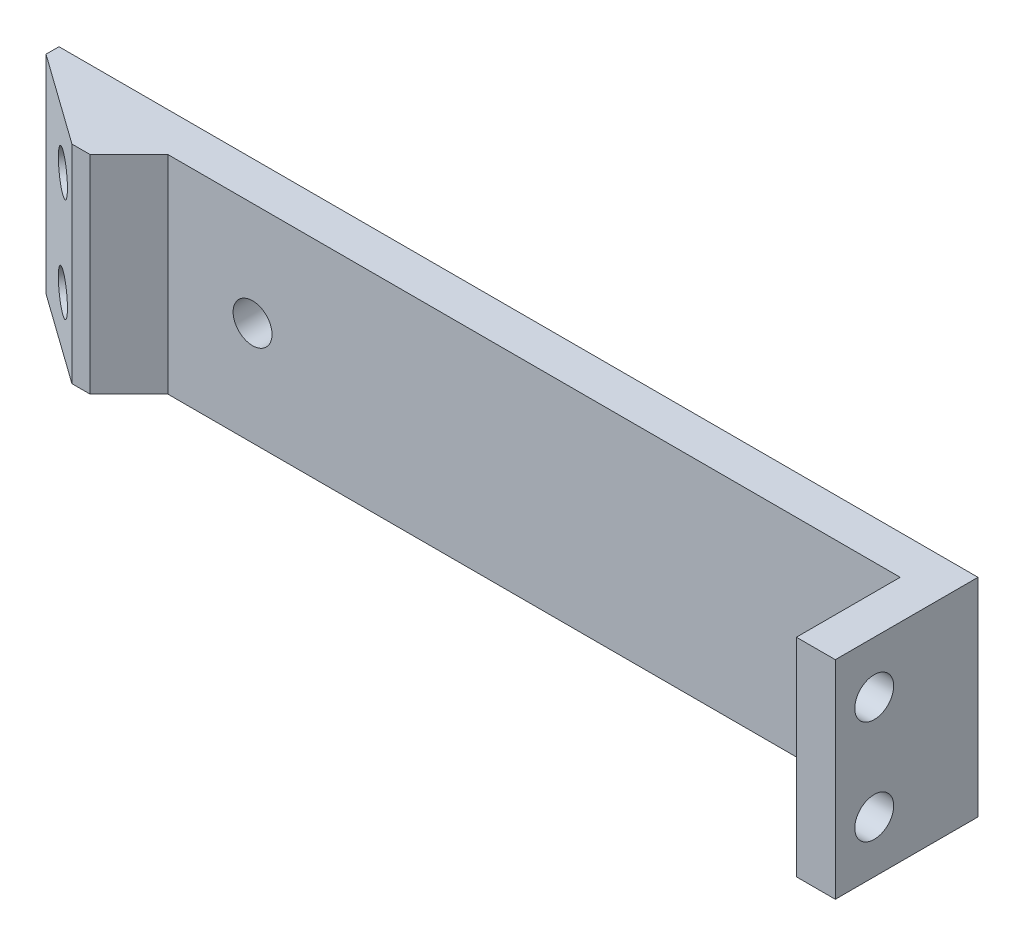
from build123d import *

# Parameters (mm, degrees)
SKETCH1_W           = 70.85
SKETCH1_H           = 16
BOSS_EXTRUDE1_DEPTH = 3
SKETCH2_W           = 8.4
SKETCH2_H           = 16
BOSS_EXTRUDE2_DEPTH = 3
CHAMFER1_SIZE       = 5
CHAMFER1_SIZE2      = 7
SKETCH3_R           = 1.5
CUT_EXTRUDE1_DEPTH  = 3
CHAMFER2_SIZE       = 3
CUT_EXTRUDE2_START  = -3
CUT_EXTRUDE2_DEPTH  = 8
SKETCH5_W           = 3
SKETCH5_H           = 16
BOSS_EXTRUDE3_DEPTH = 8
SKETCH6_R           = 1.5
CUT_EXTRUDE3_DEPTH  = 8
SKETCH7_R           = 1.5
CUT_EXTRUDE4_DEPTH  = 10


with BuildPart() as part:
    # Sketch1 → Boss-Extrude1 (new body)
    with BuildSketch(Plane.XY):
        Rectangle(SKETCH1_W, SKETCH1_H)
    extrude(amount=BOSS_EXTRUDE1_DEPTH)

    # Sketch2 → Boss-Extrude2 (add)
    with BuildSketch(Plane.XY.offset(3)):
        with Locations((-31.225, 0)):
            Rectangle(SKETCH2_W, SKETCH2_H)
    extrude(amount=BOSS_EXTRUDE2_DEPTH)

    # Chamfer1
    chamfer1_edges = [part.edges().sort_by_distance(p)[0] for p in [
        (-35.425, 0, 6),
    ]]
    chamfer1_side = [part.faces().sort_by_distance(p)[0] for p in [
        (-35.425, 0, 3),
    ]]
    chamfer(chamfer1_edges, length=CHAMFER1_SIZE, length2=CHAMFER1_SIZE2, reference=chamfer1_side[0])

    # Sketch3 → Cut-Extrude1 (cut)
    with BuildSketch(Plane(origin=(-12.440878378, 0, 17.41722973), x_dir=(0.8137334712067354, 0, 0.5812381937190957), z_dir=(-0.5812381937190957, 0, 0.8137334712067354))):
        with Locations((-22.642944757, 4)):
            Circle(SKETCH3_R)
        with Locations((-22.642944757, -4)):
            Circle(SKETCH3_R)
    extrude(amount=-CUT_EXTRUDE1_DEPTH, mode=Mode.SUBTRACT)

    # Chamfer2
    chamfer2_edges = [part.edges().sort_by_distance(p)[0] for p in [
        (-27.025, 0, 3),
    ]]
    chamfer(chamfer2_edges, length=CHAMFER2_SIZE - 0.0001)  # a hair under: the kernel refuses the full size

    # Sketch4 → Cut-Extrude2 (cut)
    with BuildSketch(Plane(origin=(-12.440878378, 0, 17.41722973), x_dir=(0.8137334712067354, 0, 0.5812381937190959), z_dir=(-0.5812381937190958, 0, 0.8137334712067353)).offset(CUT_EXTRUDE2_START)):
        Polygon((-19.467518276, 4), (-21.055231516, 6.75), (-24.230657997, 6.75), (-25.818371237, 4), (-24.230657997, 1.25), (-21.055231516, 1.25), align=None)
        Polygon((-19.467518276, -4), (-21.055231516, -1.25), (-24.230657997, -1.25), (-25.818371237, -4), (-24.230657997, -6.75), (-21.055231516, -6.75), align=None)
    extrude(amount=-CUT_EXTRUDE2_DEPTH, mode=Mode.SUBTRACT)

    # Sketch5 → Boss-Extrude3 (add)
    with BuildSketch(Plane.XY.offset(3)):
        with Locations((33.925, 0)):
            Rectangle(SKETCH5_W, SKETCH5_H)
    extrude(amount=BOSS_EXTRUDE3_DEPTH)

    # Sketch6 → Cut-Extrude3 (cut)
    with BuildSketch(Plane(origin=(35.425, 0, 0), x_dir=(0, 0, -1), z_dir=(1, 0, 0))):
        with Locations((-8, 4)):
            Circle(SKETCH6_R)
        with Locations((-8, -4)):
            Circle(SKETCH6_R)
    extrude(amount=-CUT_EXTRUDE3_DEPTH, mode=Mode.SUBTRACT)

    # Sketch7 → Cut-Extrude4 (cut)
    with BuildSketch(Plane(origin=(0, 0, 0), x_dir=(-1, 0, 0), z_dir=(0, 0, -1))):
        with Locations((17.5, 0)):
            Circle(SKETCH7_R)
    extrude(amount=-CUT_EXTRUDE4_DEPTH, mode=Mode.SUBTRACT)


solid = part.part
